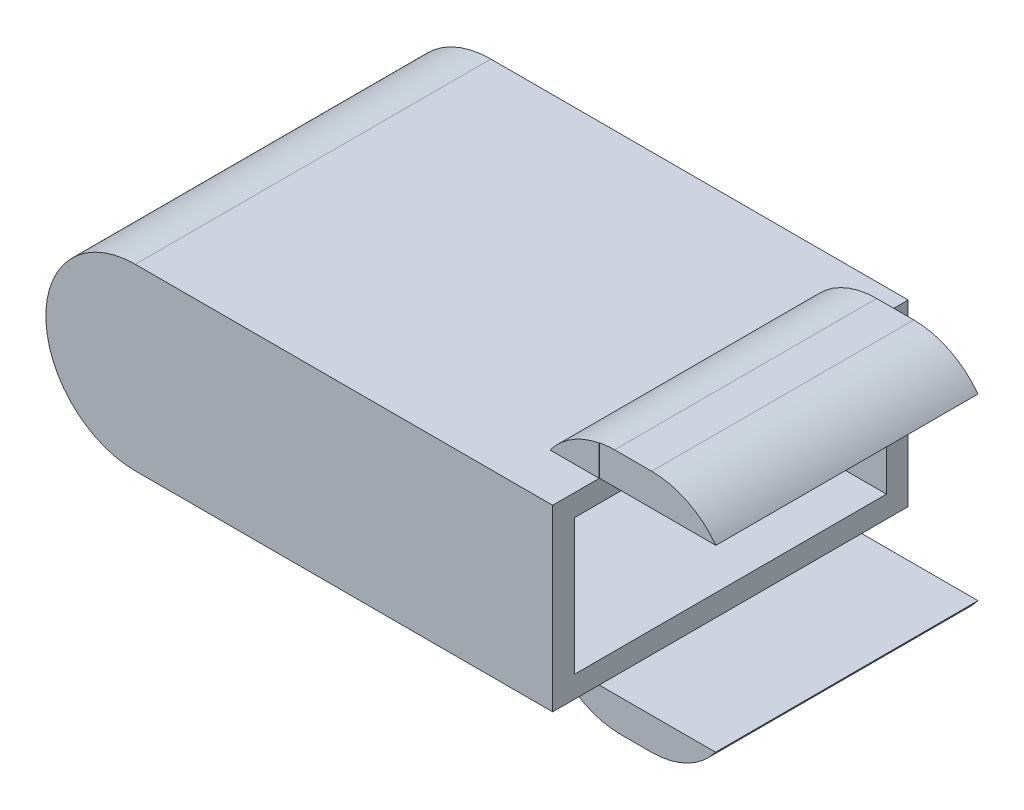
from build123d import *

# Parameters (mm, degrees)
ESQUISSE1_W             = 52
ESQUISSE1_H             = 44.3
BOSS_EXTRU_1_DEPTH      = 22.3
ESQUISSE4_W             = 38.9
ESQUISSE4_H             = 16.9
ENL_V_MAT_EXTRU_2_DEPTH = 52
BOSS_EXTRU_3_DEPTH      = 44.3
ESQUISSE9_W             = 5.32335475
ESQUISSE9_H             = 32.7
BOSS_EXTRU_4_DEPTH      = 4
ESQUISSE10_W            = 32.7
ESQUISSE10_H            = 4
BOSS_EXTRU_5_DEPTH      = 14.5
ESQUISSE11_W            = 6.122616958
ESQUISSE11_H            = 32.7
BOSS_EXTRU_6_DEPTH      = 4
ESQUISSE12_W            = 32.660291113
ESQUISSE12_H            = 4
BOSS_EXTRU_7_DEPTH      = 14.5
CONG_1_R                = 10
CONG_2_R                = 10
CONG_3_R                = 10
CONG_4_R                = 10


with BuildPart() as part:
    # Esquisse1 → Boss.-Extru.1 (new body)
    with BuildSketch(Plane(origin=(0, 0, 0), x_dir=(1, 0, 0), z_dir=(0, 1, 0))):
        with Locations((-7.759163987, 0)):
            Rectangle(ESQUISSE1_W, ESQUISSE1_H)
    extrude(amount=BOSS_EXTRU_1_DEPTH)

    # Esquisse4 → Enlèv. mat.-Extru.2 (cut)
    with BuildSketch(Plane(origin=(18.240836013, 0, 0), x_dir=(0, 0, -1), z_dir=(1, 0, 0))):
        with Locations((0, 11.15)):
            Rectangle(ESQUISSE4_W, ESQUISSE4_H)
    extrude(amount=-ENL_V_MAT_EXTRU_2_DEPTH, mode=Mode.SUBTRACT)

    # Esquisse5 → Boss.-Extru.3 (add)
    with BuildSketch(Plane.XY.offset(22.15)):
        with BuildLine():
            Line((-33.759163987, 22.3), (-33.759163987, 0))
            ThreePointArc((-33.759163987, 0), (-44.909163987, 11.15), (-33.759163987, 22.3))
        make_face()
    extrude(amount=-BOSS_EXTRU_3_DEPTH)

    # Esquisse9 → Boss.-Extru.4 (add)
    with BuildSketch(Plane.XZ):
        with Locations((15.579158638, 0)):
            Rectangle(ESQUISSE9_W, ESQUISSE9_H)
    extrude(amount=BOSS_EXTRU_4_DEPTH)

    # Esquisse10 → Boss.-Extru.5 (add)
    with BuildSketch(Plane(origin=(18.240836013, 0, 0), x_dir=(0, 0, -1), z_dir=(1, 0, 0))):
        with Locations((0, -2)):
            Rectangle(ESQUISSE10_W, ESQUISSE10_H)
    extrude(amount=BOSS_EXTRU_5_DEPTH)

    # Esquisse11 → Boss.-Extru.6 (add)
    with BuildSketch(Plane(origin=(0, 22.3, 0), x_dir=(1, 0, 0), z_dir=(0, 1, 0))):
        with Locations((15.179527534, 0)):
            Rectangle(ESQUISSE11_W, ESQUISSE11_H)
    extrude(amount=BOSS_EXTRU_6_DEPTH)

    # Esquisse12 → Boss.-Extru.7 (add)
    with BuildSketch(Plane(origin=(18.240836013, 0, 0), x_dir=(0, 0, -1), z_dir=(1, 0, 0))):
        with Locations((0.019854443, 24.3)):
            Rectangle(ESQUISSE12_W, ESQUISSE12_H)
    extrude(amount=BOSS_EXTRU_7_DEPTH)

    # Congé1
    # the kernel refuses this fillet: 10 mm, written as the material it takes off along each edge
    with BuildSketch(Plane(origin=(12.917481263, -4, -36.35), x_dir=(1, 0, 0), z_dir=(0, 0, 1))) as cong_1_piece_1:
        with BuildLine():
            CenterArc((8, 10), CONG_1_R, 216.869897646, 53.130102354)
            Line((0, 4), (-0.16, 3.88))
            ThreePointArc((-0.16, 3.88), (-0.2, 2), (-0.2, 0))
            Line((-0.2, 0), (0, -0.2))
            Line((0, -0.2), (8, -0.2))
            Line((8, -0.2), (8, 0))
        make_face()
    extrude(amount=72.7, mode=Mode.SUBTRACT)

    # Congé2
    # the kernel refuses this fillet: 10 mm, written as the material it takes off along each edge
    with BuildSketch(Plane(origin=(12.118219055, 26.3, 36.35), x_dir=(1, 0, 0), z_dir=(0, 0, -1))) as cong_2_piece_1:
        with BuildLine():
            CenterArc((8, 10), CONG_2_R, 216.869897646, 53.130102354)
            Line((0, 4), (-0.16, 3.88))
            ThreePointArc((-0.16, 3.88), (-0.2, 2), (-0.2, 0))
            Line((-0.2, 0), (0, -0.2))
            Line((0, -0.2), (8, -0.2))
            Line((8, -0.2), (8, 0))
        make_face()
    extrude(amount=72.7, mode=Mode.SUBTRACT)

    # Congé3
    # the kernel refuses this fillet: 10 mm, written as the material it takes off along each edge
    with BuildSketch(Plane(origin=(32.740836013, -4, -36.35), x_dir=(-1, 0, 0), z_dir=(0, 0, 1))) as cong_3_piece_1:
        with BuildLine():
            CenterArc((8, -10), CONG_3_R, 90, 53.130102354)
            Line((0, -4), (-0.16, -3.88))
            ThreePointArc((-0.16, -3.88), (-0.2, -2), (-0.2, 0))
            Line((-0.2, 0), (0, 0.2))
            Line((0, 0.2), (8, 0.2))
            Line((8, 0.2), (8, 0))
        make_face()
    extrude(amount=72.7, mode=Mode.SUBTRACT)

    # Congé4
    # the kernel refuses this fillet: 10 mm, written as the material it takes off along each edge
    with BuildSketch(Plane(origin=(32.740836013, 26.3, -36.35), x_dir=(0, -1, 0), z_dir=(0, 0, 1))) as cong_4_piece_1:
        with BuildLine():
            CenterArc((10, -8), CONG_4_R, 126.869897646, 53.130102354)
            Line((0, -8), (-0.2, -8))
            Line((-0.2, -8), (-0.2, 0))
            Line((-0.2, 0), (0, 0.2))
            ThreePointArc((0, 0.2), (2, 0.2), (3.88, 0.16))
            Line((3.88, 0.16), (4, 0))
        make_face()
    extrude(amount=72.660291113, mode=Mode.SUBTRACT)


solid = part.part
